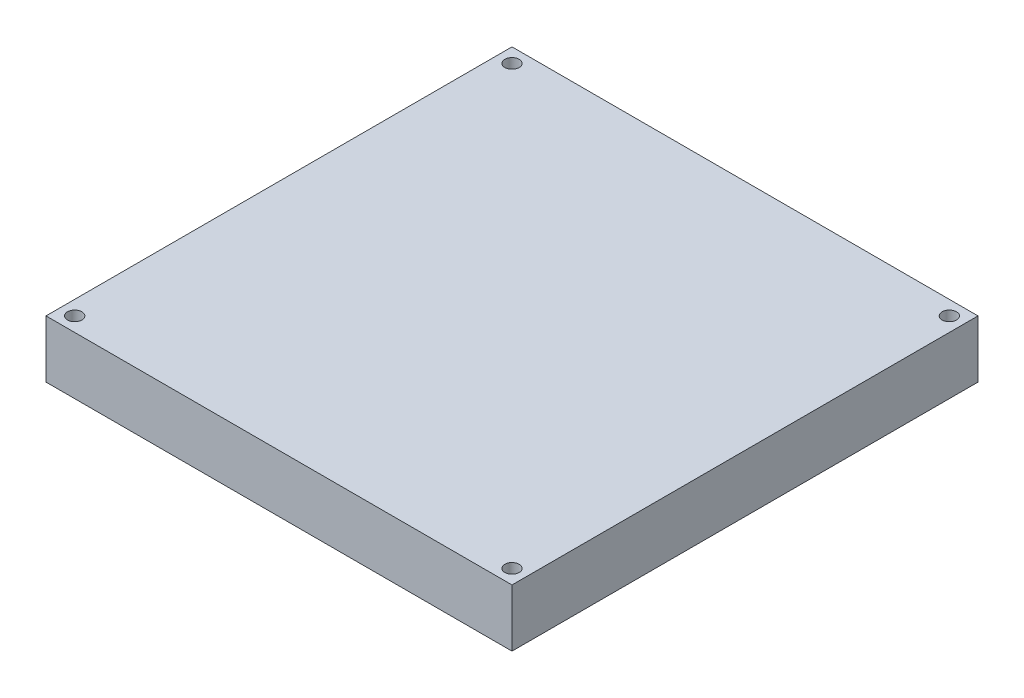
from build123d import *

# Parameters (mm, degrees)
SKETCH1_W                   = 32.5
SKETCH1_H                   = 32.5
BOSS_EXTRUDE1_DEPTH         = 4
F_1_0MM_PRESS_DOWEL_HOLE1_D = 1


with BuildPart() as part:
    # Sketch1 → Boss-Extrude1 (new body)
    with BuildSketch(Plane(origin=(0, 0, 0), x_dir=(1, 0, 0), z_dir=(0, 1, 0))):
        Rectangle(SKETCH1_W, SKETCH1_H)
    extrude(amount=BOSS_EXTRUDE1_DEPTH)

    # Ø1.0mm Press Dowel Hole1 (through all)
    with Locations(Plane(origin=(0, 4, 0), x_dir=(1, 0, 0), z_dir=(0, 1, 0))):
        with Locations((-15.25, 15.25), (15.25, 15.25), (15.25, -15.25), (-15.25, -15.25)):
            Hole(F_1_0MM_PRESS_DOWEL_HOLE1_D / 2)


solid = part.part
